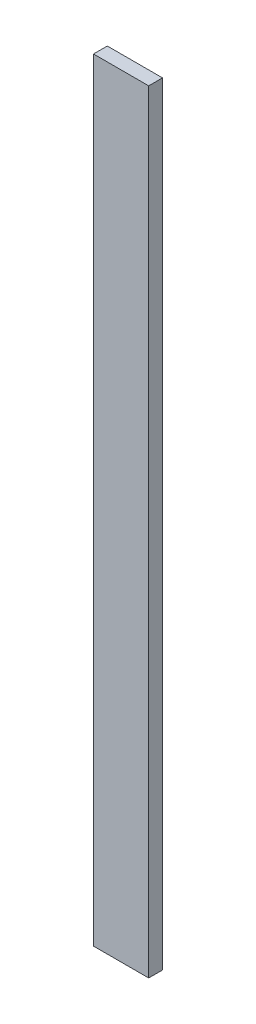
from build123d import *

# Parameters (mm, degrees)
ESQUISSE2_W        = 25.4
ESQUISSE2_H        = 355.6
BOSS_EXTRU_1_DEPTH = 6.35


with BuildPart() as part:
    # Esquisse2 → Boss.-Extru.1 (new body)
    with BuildSketch(Plane.XY):
        Rectangle(ESQUISSE2_W, ESQUISSE2_H)
    extrude(amount=BOSS_EXTRU_1_DEPTH)


solid = part.part
